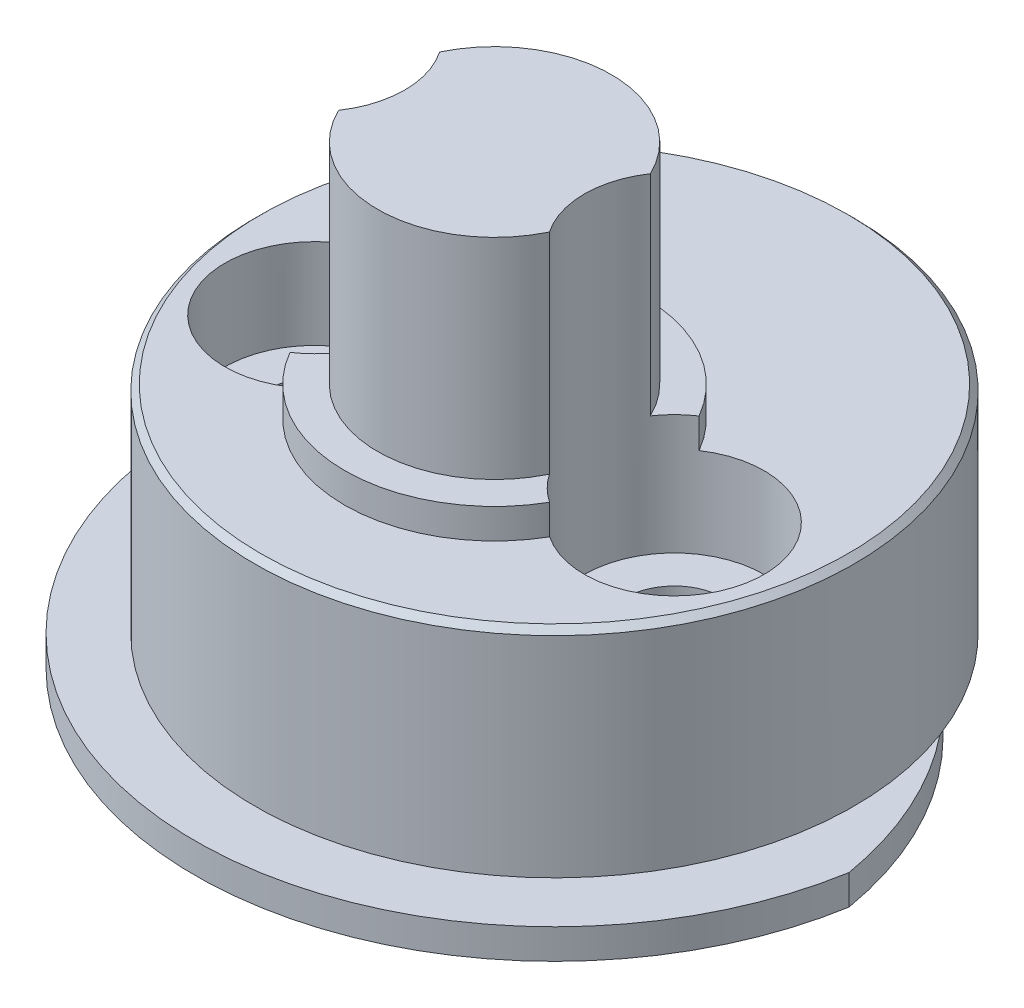
from build123d import *

# Parameters (mm, degrees)
SKETCH1_R               = 1.65
SKETCH1_W               = 5.5
SKETCH1_H               = 10.5
BOSS_EXTRUDE1_DEPTH     = 1
SKETCH2_R               = 10
SKETCH2_R_2             = 1.65
SKETCH2_W               = 5.5
SKETCH2_H               = 10.5
BOSS_EXTRUDE2_DEPTH     = 4.2
SKETCH3_R               = 10
SKETCH3_R_2             = 1.65
BOSS_EXTRUDE3_DEPTH     = 3
SKETCH4_R               = 5
BOSS_EXTRUDE4_DEPTH     = 1
SKETCH5_R               = 3.9
BOSS_EXTRUDE5_DEPTH     = 7
CUT_EXTRUDE1_DEPTH      = 10
CUT_EXTRUDE1_DEPTH_BACK = 4
SKETCH6_R               = 3
CHAMFER1_SIZE           = 0.2


with BuildPart() as part:
    # Sketch1 → Boss-Extrude1 (new body)
    with BuildSketch(Plane(origin=(0, 0, 0), x_dir=(1, 0, 0), z_dir=(0, 1, 0))):
        with BuildLine():
            ThreePointArc((-11.832159566, 0), (0, -10), (11.832159566, 0))
            ThreePointArc((11.832159566, 0), (0, 10), (-11.832159566, 0))
        make_face()
        with Locations((-6, 0)):
            Circle(SKETCH1_R, mode=Mode.SUBTRACT)
        with Locations((6, 0)):
            Circle(SKETCH1_R, mode=Mode.SUBTRACT)
        Rectangle(SKETCH1_W, SKETCH1_H, mode=Mode.SUBTRACT)
    extrude(amount=BOSS_EXTRUDE1_DEPTH)

    # Sketch2 → Boss-Extrude2 (add)
    with BuildSketch(Plane(origin=(0, 1, 0), x_dir=(1, 0, 0), z_dir=(0, 1, 0))):
        with Locations((0, 2)):
            Circle(SKETCH2_R)
        with Locations((6, 0)):
            Circle(SKETCH2_R_2, mode=Mode.SUBTRACT)
        with Locations((-6, 0)):
            Circle(SKETCH2_R_2, mode=Mode.SUBTRACT)
        Rectangle(SKETCH2_W, SKETCH2_H, mode=Mode.SUBTRACT)
    extrude(amount=BOSS_EXTRUDE2_DEPTH)

    # Sketch3 → Boss-Extrude3 (add)
    with BuildSketch(Plane(origin=(0, 5.2, 0), x_dir=(1, 0, 0), z_dir=(0, 1, 0))):
        with Locations((0, 2)):
            Circle(SKETCH3_R)
        with Locations((6, 0)):
            Circle(SKETCH3_R_2, mode=Mode.SUBTRACT)
        with Locations((-6, 0)):
            Circle(SKETCH3_R_2, mode=Mode.SUBTRACT)
    extrude(amount=BOSS_EXTRUDE3_DEPTH)

    # Sketch4 → Boss-Extrude4 (add)
    with BuildSketch(Plane(origin=(0, 8.2, 0), x_dir=(1, 0, 0), z_dir=(0, 1, 0))):
        Circle(SKETCH4_R)
    extrude(amount=BOSS_EXTRUDE4_DEPTH)

    # Sketch5 → Boss-Extrude5 (add)
    with BuildSketch(Plane(origin=(0, 9.2, 0), x_dir=(1, 0, 0), z_dir=(0, 1, 0))):
        Circle(SKETCH5_R)
    extrude(amount=BOSS_EXTRUDE5_DEPTH)

    # Sketch6 → Cut-Extrude1 (cut, two sides: drawn at the far end of the back side and taken through both)
    with BuildSketch(Plane(origin=(0, 9.2, 0), x_dir=(1, 0, 0), z_dir=(0, 1, 0)).offset(-CUT_EXTRUDE1_DEPTH_BACK)):
        with Locations((-6, 0)):
            Circle(SKETCH6_R)
        with Locations((6, 0)):
            Circle(SKETCH6_R)
    extrude(amount=CUT_EXTRUDE1_DEPTH + CUT_EXTRUDE1_DEPTH_BACK, mode=Mode.SUBTRACT)

    # Chamfer1
    chamfer1_edges = [part.edges().sort_by_distance(p)[0] for p in [
        (-10, 8.2, -2),
    ]]
    chamfer(chamfer1_edges, length=CHAMFER1_SIZE)


solid = part.part
